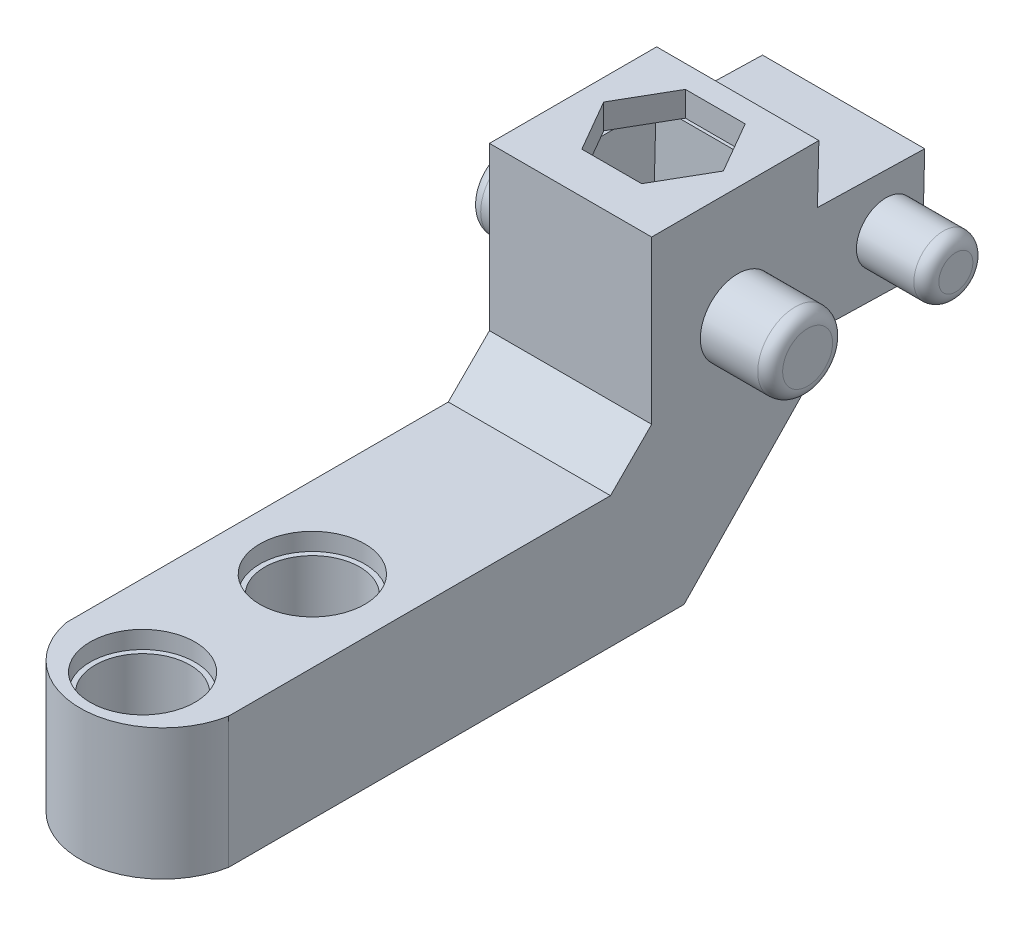
from build123d import *

# Parameters (mm, degrees)
BOSS_EXTRUDE3_DEPTH  = 6.5
SKETCH5_W            = 6.5
SKETCH5_H            = 5.25
BOSS_EXTRUDE4_DEPTH  = 19.65
SKETCH7_W            = 6.5
SKETCH7_H            = 1.65
BOSS_EXTRUDE5_DEPTH  = 1.65
CUT_EXTRUDE1_DEPTH   = 25.96938125
SKETCH10_R           = 1.5
BOSS_EXTRUDE6_DEPTH  = 2.8
FILLET5_R            = 0.5
BOSS_EXTRUDE7_START  = 2.8
BOSS_EXTRUDE7_DEPTH  = 2.8
CUT_EXTRUDE5_DEPTH   = 27.20157438
CUT_EXTRUDE13_DEPTH  = 0.7
SKETCH23_R           = 1.9
CUT_EXTRUDE14_DEPTH  = 27.427684348
SKETCH20_R           = 2.102432725
CUT_EXTRUDE15_DEPTH  = 0.7
SKETCH24_R           = 1.9
CUT_EXTRUDE16_DEPTH  = 27.427684348
SHELL3_START         = -6.9
SHELL3_DEPTH         = 4.25
SHELL3_2_DEPTH       = 3.55
SHELL3_START_2       = 1
SHELL3_3_DEPTH       = 4.5
SHELL3_START_3       = -1.8
SHELL3_4_OUTLINE_R   = 0.5
SHELL3_4_DEPTH       = 10.1
CUT_EXTRUDE21_DEPTH  = 1
SKETCH27_W           = 6.5
SKETCH27_H           = 4.25
BOSS_EXTRUDE8_DEPTH  = 4.3
SKETCH30_R           = 1.182465124
BOSS_EXTRUDE9_DEPTH  = 2.8
FILLET7_R            = 0.5
SKETCH32_R           = 1.225
BOSS_EXTRUDE11_DEPTH = 2.8
FILLET8_R            = 0.5
SKETCH35_W           = 4.5
SKETCH35_H           = 3.3
CUT_EXTRUDE22_DEPTH  = 3.5


with BuildPart() as part:
    # Sketch4 → Boss-Extrude3 (new body)
    with BuildSketch(Plane(origin=(0, 0, 0), x_dir=(0, 0, -1), z_dir=(1, 0, 0))):
        Polygon((3.25, 6.5), (3.05, -1.497710452), (-2.152769119, -6.9), (-3.45, -6.9), (-3.45, 6.5), align=None)
    extrude(amount=BOSS_EXTRUDE3_DEPTH)

    # Sketch5 → Boss-Extrude4 (add)
    with BuildSketch(Plane.XY.offset(3.45)):
        with Locations((3.25, -4.275)):
            Rectangle(SKETCH5_W, SKETCH5_H)
    extrude(amount=BOSS_EXTRUDE4_DEPTH)

    # Sketch7 → Boss-Extrude5 (add)
    with BuildSketch(Plane.XY.offset(3.45)):
        with Locations((3.25, -0.825)):
            Rectangle(SKETCH7_W, SKETCH7_H)
    extrude(amount=BOSS_EXTRUDE5_DEPTH)

    # Sketch8 → Cut-Extrude1 (cut, through all)
    with BuildSketch(Plane(origin=(6.5, 0, 0), x_dir=(0, 0, -1), z_dir=(1, 0, 0))):
        Polygon((-3.45, 0), (-5.1, -1.65), (-5.1, 0), align=None)
    extrude(amount=-CUT_EXTRUDE1_DEPTH, mode=Mode.SUBTRACT)

    # Sketch10 → Boss-Extrude6 (add)
    with BuildSketch(Plane(origin=(6.5, 0, 0), x_dir=(0, 0, -1), z_dir=(1, 0, 0))):
        with Locations((0, 2)):
            Circle(SKETCH10_R)
    extrude(amount=BOSS_EXTRUDE6_DEPTH)

    # Fillet5
    fillet5_edges = [part.edges().sort_by_distance(p)[0] for p in [
        (9.3, 2, 1.5),
    ]]
    fillet(fillet5_edges, radius=FILLET5_R)

    # Sketch13 → Boss-Extrude7 (add)
    with BuildSketch(Plane.ZY.offset(BOSS_EXTRUDE7_START)):
        with BuildLine():
            ThreePointArc((-1.5, 2), (-1.060660172, 0.939339828), (0, 0.5))
            Line((0, 0.5), (0, 2))
            Line((0, 2), (-1.5, 2))
        make_face()
        with BuildLine():
            Line((0, 2), (0, 0.5))
            ThreePointArc((0, 0.5), (1.060660172, 0.939339828), (1.5, 2))
            Line((1.5, 2), (0, 2))
        make_face()
        with BuildLine():
            Line((-1.5, 2), (0, 2))
            Line((0, 2), (0, 3.5))
            ThreePointArc((0, 3.5), (-1.060660172, 3.060660172), (-1.5, 2))
        make_face()
        with BuildLine():
            Line((0, 3.5), (0, 2))
            Line((0, 2), (1.5, 2))
            ThreePointArc((1.5, 2), (1.060660172, 3.060660172), (0, 3.5))
        make_face()
    extrude(amount=-BOSS_EXTRUDE7_DEPTH)

    # Fillet6: read off the stored shape, not the designer's step
    # Fillet6 outline → Fillet6 (revolve, cut)
    with BuildSketch(Plane(origin=(0, 2, 0), x_dir=(0, 1, 0), z_dir=(0, 0, -1))):
        with BuildLine():
            Line((1.5, -2.8), (1.5, -2.3))
            ThreePointArc((1.5, -2.3), (1.353553391, -2.653553391), (1, -2.8))
            Line((1, -2.8), (1.5, -2.8))
        make_face()
    revolve(axis=Axis((0, 2, 0), (1, 0, 0)), mode=Mode.SUBTRACT)

    # Sketch15 → Cut-Extrude5 (cut, through all)
    with BuildSketch(Plane(origin=(0, -1.65, 0), x_dir=(1, 0, 0), z_dir=(0, 1, 0))):
        with BuildLine():
            Line((0, -23.1), (3.25, -23.1))
            ThreePointArc((3.25, -23.1), (1.137389056, -22.336939099), (0, -20.4))
            Line((0, -20.4), (0, -23.1))
        make_face()
        with BuildLine():
            Line((6.5, -23.1), (6.5, -20.4))
            ThreePointArc((6.5, -20.4), (5.362610944, -22.336939099), (3.25, -23.1))
            Line((3.25, -23.1), (6.5, -23.1))
        make_face()
    extrude(amount=-CUT_EXTRUDE5_DEPTH, mode=Mode.SUBTRACT)

    # Sketch16 → Cut-Extrude13 (cut)
    with BuildSketch(Plane(origin=(0, -1.65, 0), x_dir=(1, 0, 0), z_dir=(0, 1, 0))):
        with BuildLine():
            ThreePointArc((3.25, -18.5), (1.15, -20.6), (3.25, -22.7))
            Line((3.25, -22.7), (3.25, -18.5))
        make_face()
        with BuildLine():
            Line((3.25, -18.5), (3.25, -22.7))
            ThreePointArc((3.25, -22.7), (4.73492424, -22.08492424), (5.35, -20.6))
            ThreePointArc((5.35, -20.6), (4.73492424, -19.11507576), (3.25, -18.5))
        make_face()
    extrude(amount=-CUT_EXTRUDE13_DEPTH, mode=Mode.SUBTRACT)

    # Sketch23 → Cut-Extrude14 (cut, through all)
    with BuildSketch(Plane(origin=(0, -2.35, 0), x_dir=(1, 0, 0), z_dir=(0, 1, 0))):
        with Locations(Location((3.25, -20.6, 0), (0, 0, 270))):
            Circle(SKETCH23_R)
    extrude(amount=-CUT_EXTRUDE14_DEPTH, mode=Mode.SUBTRACT)

    # Sketch20 → Cut-Extrude15 (cut)
    with BuildSketch(Plane(origin=(0, -1.65, 0), x_dir=(1, 0, 0), z_dir=(0, 1, 0))):
        with Locations(Location((3.25, -13.797567275, 0), (0, 0, 270))):
            Circle(SKETCH20_R)
    extrude(amount=-CUT_EXTRUDE15_DEPTH, mode=Mode.SUBTRACT)

    # Sketch24 → Cut-Extrude16 (cut, through all)
    with BuildSketch(Plane(origin=(0, -2.35, 0), x_dir=(1, 0, 0), z_dir=(0, 1, 0))):
        with Locations(Location((3.25, -13.797567275, 0), (0, 0, 270))):
            Circle(SKETCH24_R)
    extrude(amount=-CUT_EXTRUDE16_DEPTH, mode=Mode.SUBTRACT)

    # Shell3: read off the stored shape, not the designer's step
    # Shell3 outline → Shell3 (cut)
    with BuildSketch(Plane(origin=(0, 0, 0), x_dir=(1, 0, 0), z_dir=(0, 1, 0)).offset(SHELL3_START)):
        with BuildLine():
            ThreePointArc((1, -11.661545549), (3.25, -10.69513455), (5.5, -11.661545549))
            Line((5.5, -11.661545549), (5.5, -2.45))
            Line((5.5, -2.45), (1, -2.45))
            Line((1, -2.45), (1, -11.661545549))
        make_face()
        with BuildLine():
            ThreePointArc((5.5, -15.933589001), (3.25, -16.9), (1, -15.933589001))
            Line((1, -15.933589001), (1, -18.467513189))
            ThreePointArc((1, -18.467513189), (3.25, -17.5), (5.5, -18.467513189))
            Line((5.5, -18.467513189), (5.5, -15.933589001))
        make_face()
    extrude(amount=SHELL3_DEPTH, mode=Mode.SUBTRACT)

    # Shell3 2 outline → Shell3 2 (cut)
    with BuildSketch(Plane(origin=(0, 0, 0), x_dir=(1, 0, 0), z_dir=(0, 1, 0)).offset(SHELL3_START)):
        with BuildLine():
            ThreePointArc((1, -11.967949829), (3.25, -10.897567275), (5.5, -11.967949829))
            Line((5.5, -11.967949829), (5.5, -11.661545549))
            ThreePointArc((5.5, -11.661545549), (3.25, -10.69513455), (1, -11.661545549))
            Line((1, -11.661545549), (1, -11.967949829))
        make_face()
        with BuildLine():
            ThreePointArc((5.5, -15.627184721), (3.25, -16.697567275), (1, -15.627184721))
            Line((1, -15.627184721), (1, -15.933589001))
            ThreePointArc((1, -15.933589001), (3.25, -16.9), (5.5, -15.933589001))
            Line((5.5, -15.933589001), (5.5, -15.627184721))
        make_face()
        with BuildLine():
            ThreePointArc((5.5, -18.467513189), (3.25, -17.5), (1, -18.467513189))
            Line((1, -18.467513189), (1, -18.770382554))
            ThreePointArc((1, -18.770382554), (3.25, -17.7), (5.5, -18.770382554))
            Line((5.5, -18.770382554), (5.5, -18.467513189))
        make_face()
    extrude(amount=SHELL3_2_DEPTH, mode=Mode.SUBTRACT)

    # Shell3 3 outline → Shell3 3 (cut)
    with BuildSketch(Plane.YZ.offset(SHELL3_START_2)):
        Polygon((-0.414213562, 2.45), (-2.65, 4.685786438), (-2.65, 2.45), (-6.9, 2.45), (-6.9, 2.152769119), (-2.564073304, -2.023020667), (5.5, -2.224680213), (5.5, 2.45), align=None)
    extrude(amount=SHELL3_3_DEPTH, mode=Mode.SUBTRACT)

    # Shell3 4 outline → Shell3 4 (cut)
    with BuildSketch(Plane.YZ.offset(SHELL3_START_3)):
        with Locations((2, 0)):
            Circle(SHELL3_4_OUTLINE_R)
    extrude(amount=SHELL3_4_DEPTH, mode=Mode.SUBTRACT)

    # Sketch25 → Cut-Extrude21 (cut)
    with BuildSketch(Plane(origin=(0, 6.5, 0), x_dir=(1, 0, 0), z_dir=(0, 1, 0))):
        Polygon((0.853996383, 0.275), (2.051998191, -1.8), (4.448001809, -1.8), (5.646003617, 0.275), (4.448001809, 2.35), (2.051998191, 2.35), align=None)
    extrude(amount=-CUT_EXTRUDE21_DEPTH, mode=Mode.SUBTRACT)

    # Sketch27 → Boss-Extrude8 (add)
    with BuildSketch(Plane(origin=(0, -0.077160181, -3.085523923), x_dir=(-1, 0, 0), z_dir=(0, -0.02499934134114434, -0.9996874676280127))):
        with Locations((-3.25, 2.154216399)):
            Rectangle(SKETCH27_W, SKETCH27_H)
    extrude(amount=BOSS_EXTRUDE8_DEPTH)

    # Sketch30 → Boss-Extrude9 (add)
    with BuildSketch(Plane(origin=(6.5, 0, 0), x_dir=(0, 0, -1), z_dir=(1, 0, 0))):
        with Locations((5.937940908, 1.983914598)):
            Circle(SKETCH30_R)
    extrude(amount=BOSS_EXTRUDE9_DEPTH)

    # Fillet7
    fillet7_edges = [part.edges().sort_by_distance(p)[0] for p in [
        (9.3, 1.983914598, -4.755475784),
    ]]
    fillet(fillet7_edges, radius=FILLET7_R)

    # Sketch32 → Boss-Extrude11 (add)
    with BuildSketch(Plane.ZY):
        with Locations(Location((-5.938343158, 2, 0), (0, 0, 180))):
            Circle(SKETCH32_R)
    extrude(amount=BOSS_EXTRUDE11_DEPTH)

    # Fillet8
    fillet8_edges = [part.edges().sort_by_distance(p)[0] for p in [
        (-2.8, 2, -4.713343158),
    ]]
    fillet(fillet8_edges, radius=FILLET8_R)

    # Sketch35 → Cut-Extrude22 (cut)
    with BuildSketch(Plane(origin=(0, 0.029207268, -0.000730391), x_dir=(1, 0, 0), z_dir=(0, -0.9996874676280127, 0.024999341341144354))):
        with Locations((3.25, -4.736488551)):
            Rectangle(SKETCH35_W, SKETCH35_H)
    extrude(amount=-CUT_EXTRUDE22_DEPTH, mode=Mode.SUBTRACT)


solid = part.part
